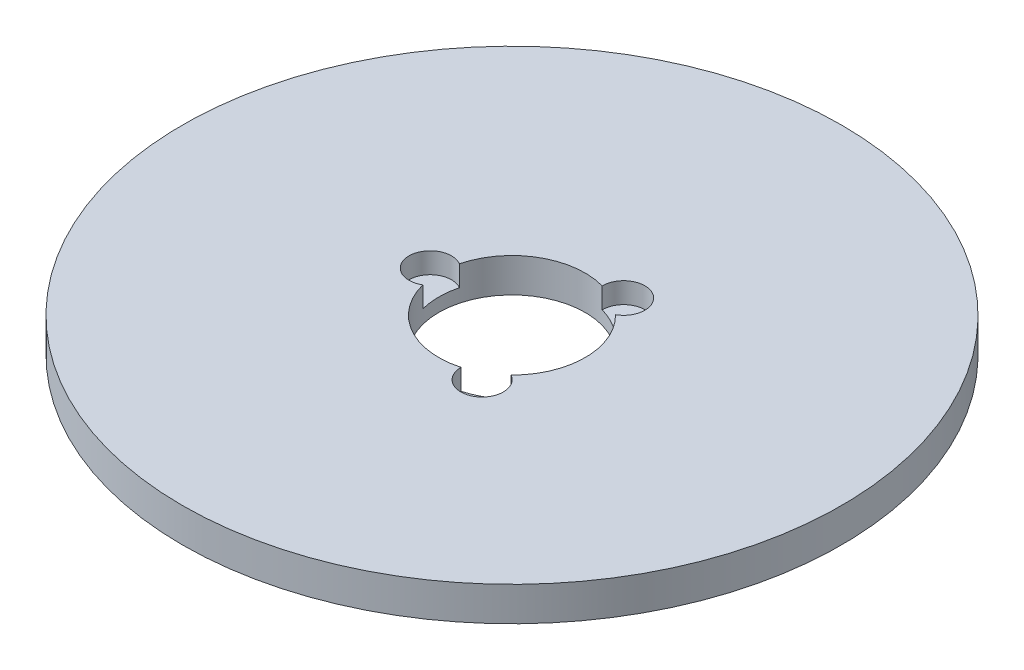
from build123d import *

# Parameters (mm, degrees)
SKETCH1_R           = 67.5
BOSS_EXTRUDE1_DEPTH = 7
SKETCH2_R           = 15
CUT_EXTRUDE1_DEPTH  = 96.715724936
SKETCH3_R           = 4.351385067
CUT_EXTRUDE2_DEPTH  = 4.250843592
CIRPATTERN1_COUNT   = 3


with BuildPart() as part:
    # Sketch1 → Boss-Extrude1 (new body)
    with BuildSketch(Plane(origin=(0, 0, 0), x_dir=(1, 0, 0), z_dir=(0, 1, 0))):
        Circle(SKETCH1_R)
    extrude(amount=BOSS_EXTRUDE1_DEPTH)

    # Sketch2 → Cut-Extrude1 (cut, through all)
    with BuildSketch(Plane(origin=(0, 0, 0), x_dir=(1, 0, 0), z_dir=(0, 1, 0))):
        Circle(SKETCH2_R)
    extrude(amount=CUT_EXTRUDE1_DEPTH, mode=Mode.SUBTRACT)

    # Sketch3 → Cut-Extrude2 (cut)
    with BuildSketch(Plane(origin=(0, 7, 0), x_dir=(1, 0, 0), z_dir=(0, 1, 0))):
        with Locations((-16.73887817, 0)):
            Circle(SKETCH3_R)
    cut_extrude2 = extrude(amount=-CUT_EXTRUDE2_DEPTH, mode=Mode.SUBTRACT)

    # CirPattern1: Cut-Extrude2 ×3 about axis
    cirpattern1_axis = Axis((0, 0, 0), (0, 1, 0))
    for i in range(1, CIRPATTERN1_COUNT):
        add(cut_extrude2.rotate(cirpattern1_axis, i * 360 / CIRPATTERN1_COUNT), mode=Mode.SUBTRACT)


solid = part.part
